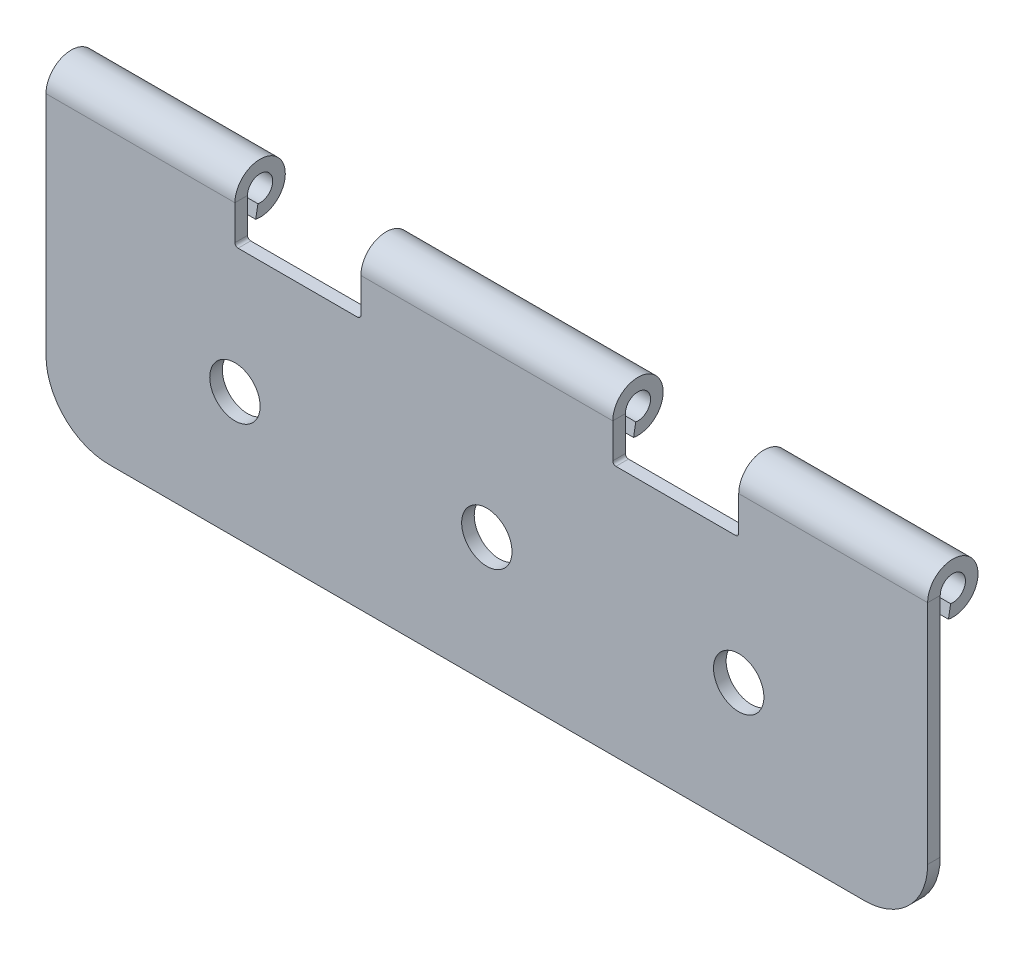
from build123d import *

# Parameters (mm, degrees)
SM_BASE_FLANGE_1_DEPTH = 1
OTHER_1_DEPTH          = 70
OTHER_START            = 25
OTHER_1_2_DEPTH        = 20
OTHER_1_3_DEPTH        = 15
OTHER_START_2          = 55
OTHER_1_4_DEPTH        = 15
SKETCH_12_R            = 2
CUT_EXTRUDE_1_DEPTH    = 10
OTHER_START_3          = -1
OTHER_1_5_DEPTH        = 1
FILLET_1_R             = 0.25
FILLET_2_R             = 5


# Read off the part's stored shape, not the designer's step: 햄1, 코너 자르기1
# Sheet-metal steps are written as plain solids
with BuildPart() as part:
    # Sketch 1 → 베이스-플랜지1 (new body)
    with BuildSketch(Plane.XY):
        Polygon((0, 0), (0, 25), (15, 25), (15, 20), (25, 20), (25, 25), (45, 25), (45, 20), (55, 20), (55, 25), (70, 25), (70, 0), align=None)
    extrude(amount=-SM_BASE_FLANGE_1_DEPTH)

    # Other 1 outline → Other 1 (cut)
    with BuildSketch(Plane.YZ):
        with BuildLine():
            ThreePointArc((23, 0), (24, -0.267949192), (24.732050807, -1))
            Line((24.732050807, -1), (25, -1))
            Line((25, -1), (25, 0))
            Line((25, 0), (23, 0))
        make_face()
    extrude(amount=OTHER_1_DEPTH, mode=Mode.SUBTRACT)

    # Other 1 2 outline → Other 1 2 (add)
    with BuildSketch(Plane.YZ.offset(OTHER_START)):
        with BuildLine():
            Line((22.015192247, -1.826351822), (21.030384494, -1.652703645))
            ThreePointArc((21.030384494, -1.652703645), (23.347296355, -3.969615506), (24.732050807, -1))
            Line((24.732050807, -1), (23, -1))
            ThreePointArc((23, -1), (23.64278761, -2.766044443), (22.015192247, -1.826351822))
        make_face()
    extrude(amount=OTHER_1_2_DEPTH)

    # Other 1 3 outline → Other 1 3 (add)
    with BuildSketch(Plane.YZ):
        with BuildLine():
            Line((22.015192247, -1.826351822), (21.030384494, -1.652703645))
            ThreePointArc((21.030384494, -1.652703645), (23.347296355, -3.969615506), (24.732050807, -1))
            Line((24.732050807, -1), (23, -1))
            ThreePointArc((23, -1), (23.64278761, -2.766044443), (22.015192247, -1.826351822))
        make_face()
    extrude(amount=OTHER_1_3_DEPTH)

    # Other 1 4 outline → Other 1 4 (add)
    with BuildSketch(Plane.YZ.offset(OTHER_START_2)):
        with BuildLine():
            Line((22.015192247, -1.826351822), (21.030384494, -1.652703645))
            ThreePointArc((21.030384494, -1.652703645), (23.347296355, -3.969615506), (24.732050807, -1))
            Line((24.732050807, -1), (23, -1))
            ThreePointArc((23, -1), (23.64278761, -2.766044443), (22.015192247, -1.826351822))
        make_face()
    extrude(amount=OTHER_1_4_DEPTH)

    # 스케치12 → 컷-돌출1 (cut)
    with BuildSketch(Plane(origin=(0, 0, -1), x_dir=(-1, 0, 0), z_dir=(0, 0, -1))):
        with Locations((-35, 10)):
            Circle(SKETCH_12_R)
        with Locations((-55, 10)):
            Circle(SKETCH_12_R)
        with Locations((-15, 10)):
            Circle(SKETCH_12_R)
    extrude(amount=-CUT_EXTRUDE_1_DEPTH, mode=Mode.SUBTRACT)

    # Other 1 5 outline → Other 1 5 (add)
    with BuildSketch(Plane.XY.offset(OTHER_START_3)):
        with BuildLine():
            Line((45, 20), (45.25, 20))
            ThreePointArc((45.25, 20), (45.073223305, 20.073223305), (45, 20.25))
            Line((45, 20.25), (45, 20))
        make_face()
        with BuildLine():
            ThreePointArc((55, 20.25), (54.926776695, 20.073223305), (54.75, 20))
            Line((54.75, 20), (55, 20))
            Line((55, 20), (55, 20.25))
        make_face()
    extrude(amount=OTHER_1_5_DEPTH)

    # 필렛1
    fillet_1_edges = [part.edges().sort_by_distance(p)[0] for p in [
        (15, 20, -0.5),
        (25, 20, -0.5),
    ]]
    fillet(fillet_1_edges, radius=FILLET_1_R)

    # 필렛2
    fillet_2_edges = [part.edges().sort_by_distance(p)[0] for p in [
        (0, 0, -0.5),
        (70, 0, -0.5),
    ]]
    fillet(fillet_2_edges, radius=FILLET_2_R)


solid = part.part
